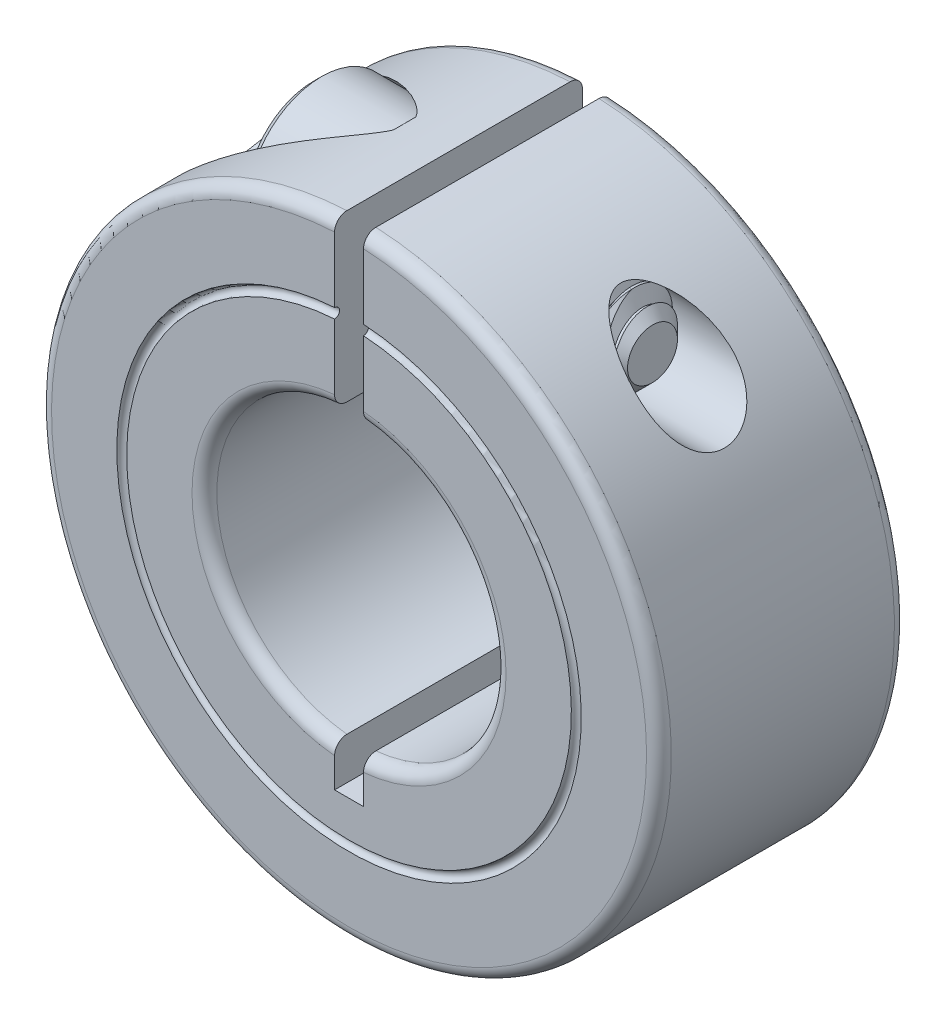
from build123d import *

# Parameters (mm, degrees)
EXTRUDE1_DEPTH     = 4.7625
FILLET1_R          = 0.47625
CUT_EXTRUDE1_DEPTH = 2.778125
CHAMFER1_SIZE      = 0.3175
CHAMFER2_SIZE      = 0.79375
CUT_SWEEP1_PITCH   = 0.79375


with BuildPart() as part:
    # Sketch1 → Extrude1 (new, symmetric)
    with BuildSketch(Plane.XY):
        with BuildLine():
            Line((-0.555625, 5.528398947), (-0.555625, 11.89327835))
            ThreePointArc((-0.555625, 11.89327835), (0, -11.90625), (0.555625, 11.89327835))
            Line((0.555625, 11.89327835), (0.555625, 5.528398947))
            ThreePointArc((0.555625, 5.528398947), (5.55625, 0), (0.555625, -5.528398947))
            Line((0.555625, -5.528398947), (0.555625, -7.14375))
            Line((0.555625, -7.14375), (-0.555625, -7.14375))
            Line((-0.555625, -7.14375), (-0.555625, -5.528398947))
            ThreePointArc((-0.555625, -5.528398947), (-5.55625, 0), (-0.555625, 5.528398947))
        make_face()
    extrude(amount=EXTRUDE1_DEPTH, both=True)

    # Fillet1
    fillet1_edges = [part.edges().sort_by_distance(p)[0] for p in [
        (-5.55625, 0, 4.7625),
        (0, -11.90625, 4.7625),
        (5.55625, 0, 4.7625),
        (5.55625, 0, -4.7625),
        (0, -11.90625, -4.7625),
        (-5.55625, 0, -4.7625),
    ]]
    fillet(fillet1_edges, radius=FILLET1_R)

    # Sketch2 → Cut-Revolve1 (revolve, cut)
    with BuildSketch(Plane(origin=(0, 0, 0), x_dir=(1, 0, 0), z_dir=(0, 1, 0))):
        with BuildLine():
            Line((-8.92175, -4.7625), (-8.54075, -4.7625))
            ThreePointArc((-8.54075, -4.7625), (-8.73125, -4.572), (-8.92175, -4.7625))
        make_face()
    revolve(axis=Axis((0, 0, -4.7625), (0, 0, 1)), mode=Mode.SUBTRACT)

    # Sketch3 → Cut-Revolve2 (revolve, cut)
    with BuildSketch(Plane.XY, mode=Mode.PRIVATE) as cut_revolve2_sk:
        Polygon((11.90625, 8.710838649), (-11.90625, 8.710838649), (-11.90625, 5.777138649), (-2.6289, 5.777138649), (-2.6289, 6.958238649), (11.90625, 6.958238649), align=None)
    revolve(cut_revolve2_sk.sketch.rotate(Axis((-11.90625, 8.710838649, 0), (-1, 0, 0)), 270), axis=Axis((-11.90625, 8.710838649, 0), (-1, 0, 0)), mode=Mode.SUBTRACT)


with BuildPart() as body_2:
    # Sketch4 → Revolve1 (revolve)
    with BuildSketch(Plane.XY):
        Polygon((-6.1341, 8.710838649), (-6.1341, 11.581038649), (-2.6289, 11.581038649), (-2.6289, 10.463438649), (6.8961, 10.463438649), (6.8961, 8.710838649), align=None)
    revolve(axis=Axis((6.8961, 8.710838649, 0), (-1, 0, 0)))

    # Sketch5 → Cut-Extrude1 (cut)
    with BuildSketch(Plane(origin=(-6.1341, 0, 0), x_dir=(0, -1, 0), z_dir=(-1, 0, 0))):
        Polygon((-7.908863041, -1.3890625), (-7.106887432, 0), (-7.908863041, 1.3890625), (-9.512814257, 1.3890625), (-10.314789866, 0), (-9.512814257, -1.3890625), align=None)
    extrude(amount=-CUT_EXTRUDE1_DEPTH, mode=Mode.SUBTRACT)

    # Chamfer1
    chamfer1_edges = [body_2.edges().sort_by_distance(p)[0] for p in [
        (-6.1341, 5.840638649, 0),
    ]]
    chamfer(chamfer1_edges, length=CHAMFER1_SIZE)

    # Chamfer2
    chamfer2_edges = [body_2.edges().sort_by_distance(p)[0] for p in [
        (6.8961, 6.958238649, 0),
    ]]
    chamfer(chamfer2_edges, length=CHAMFER2_SIZE)

    # Cut-Sweep1: arcs per turn and ends read off the stored shape
    # Cut-Sweep1: the profile of Sketch7 screwed along a right-hand helix through 12 turns, 8 arcs to a turn; built about Z, then put on its axis
    cut_sweep1_z = Axis((0, 0, 0), (0, 0, 1))
    cut_sweep1_corners = [(1.237044252, -2.16e-07, -0.496093772), (1.237044252, -2.16e-07, -0.595312522), (1.795562979, -3.13e-07, -0.91777346), (1.795562979, -3.13e-07, -0.173632835)]
    with BuildLine(mode=Mode.PRIVATE) as cut_sweep1_profile:
        Line(cut_sweep1_corners[0], cut_sweep1_corners[1])
        Line(cut_sweep1_corners[1], cut_sweep1_corners[2])
        Line(cut_sweep1_corners[2], cut_sweep1_corners[3])
        Line(cut_sweep1_corners[3], cut_sweep1_corners[0])
    cut_sweep1_cap = Face(cut_sweep1_profile.wire())
    cut_sweep1_turn_angles = [0, 22.5, 45, 67.5, 90, 112.5, 135, 157.5, 180, 202.5, 225, 247.5, 270, 292.5, 315, 337.5, 360]
    cut_sweep1_turn_weights = [1, 0.9238795325112867, 1, 0.9238795325112867, 1, 0.9238795325112867, 1, 0.9238795325112867, 1, 0.9238795325112867, 1, 0.9238795325112867, 1, 0.9238795325112867, 1, 0.9238795325112867, 1]
    cut_sweep1_turn_rails = [Edge.make_bspline([Vector(p[0], p[1], 0).rotate(cut_sweep1_z, cut_sweep1_turn_angles[k]) / cut_sweep1_turn_weights[k] + Vector(0, 0, p[2] + CUT_SWEEP1_PITCH * cut_sweep1_turn_angles[k] / 360) for k in range(17)], [0, 0, 0, 1, 1, 2, 2, 3, 3, 4, 4, 5, 5, 6, 6, 7, 7, 8, 8, 8], 2, cut_sweep1_turn_weights) for p in cut_sweep1_corners]
    cut_sweep1_turn_sides = [Face.make_surface_from_curves(cut_sweep1_turn_rails[p[0]], cut_sweep1_turn_rails[p[1]]) for p in [(0, 1), (1, 2), (2, 3), (3, 0)]]
    cut_sweep1 = Plane(origin=(6.8961, 8.710838649, 0), x_dir=(0, 0, 1), z_dir=(-1, 0, 0)) * Solid(Shell([*[p.moved(Location((0, 0, CUT_SWEEP1_PITCH * i))) for i in range(12) for p in cut_sweep1_turn_sides], cut_sweep1_cap, cut_sweep1_cap.rotate(cut_sweep1_z, 4320).moved(Location((0, 0, CUT_SWEEP1_PITCH * 4320 / 360)))]))
    add(cut_sweep1, mode=Mode.SUBTRACT)


solid = Compound([part.part, body_2.part])
